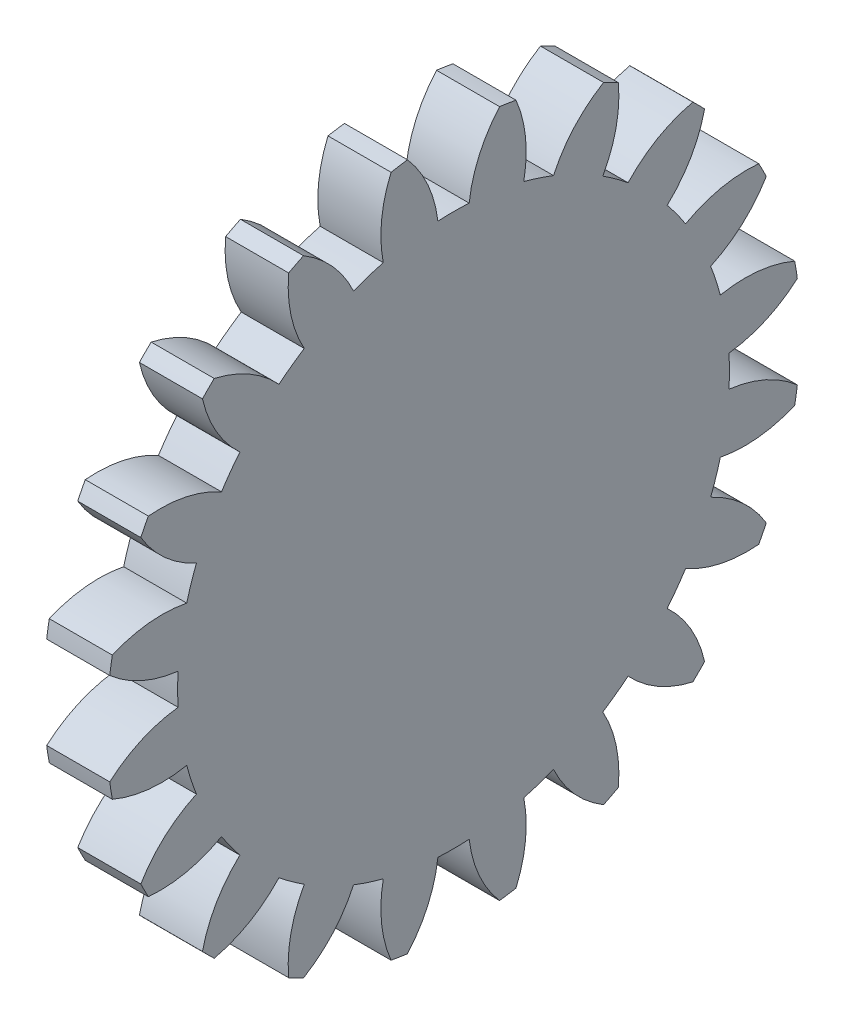
from build123d import *

# Parameters (mm, degrees)
ISO_START                                 = 2.649023341
ISO_SPUR_GEAR_1_5M_20T_20PA_3FW_2_R       = 0.4
ISO_SPUR_GEAR_1_5M_20T_20PA_3FW_S20_DEPTH = 3
BOSS_EXTRUDE1_DEPTH                       = 4
BOSS_EXTRUDE1_DEPTH_BACK                  = 3
SKETCH1_R                                 = 3
SKETCH2_R                                 = 2.4
CUT_EXTRUDE1_DEPTH                        = 3.2


# Read off the part's stored shape, not the designer's step: ISO - Spur gear 1.5M 20T 20PA 3FW ---S20A75H50L0.8N
with BuildPart() as part:
    # ISO - Spur gear 1.5M 20T 20PA 3FW -- 2 → ISO - Spur gear 1.5M 20T 20PA 3FW ---S20 (new body)
    with BuildSketch(Plane.YZ.offset(ISO_START)):
        with BuildLine():
            ThreePointArc((-13.663753379, 26.133903668), (-14.053655616, 26.200458221), (-14.445041168, 26.257647498))
            ThreePointArc((-14.445041168, 26.257647498), (-15.414573535, 24.741730478), (-15.891009909, 23.006505477))
            ThreePointArc((-15.891009909, 23.006505477), (-16.634824289, 23.027600602), (-17.37863867, 23.006505477))
            ThreePointArc((-17.37863867, 23.006505477), (-17.855075045, 24.741730477), (-18.824607411, 26.257647498))
            ThreePointArc((-18.824607411, 26.257647498), (-19.215992963, 26.200458221), (-19.6058952, 26.133903668))
            ThreePointArc((-19.6058952, 26.133903668), (-20.059531154, 24.39257893), (-19.976435058, 22.59505495))
            ThreePointArc((-19.976435058, 22.59505495), (-20.690363323, 22.385266321), (-21.391254085, 22.135352381))
            ThreePointArc((-21.391254085, 22.135352381), (-22.380586018, 23.638422489), (-23.771110214, 24.780543271))
            ThreePointArc((-23.771110214, 24.780543271), (-24.125667535, 24.605208251), (-24.475920111, 24.421424692))
            ThreePointArc((-24.475920111, 24.421424692), (-24.369254604, 22.625145234), (-23.734760063, 20.941276444))
            ThreePointArc((-23.734760063, 20.941276444), (-24.348917941, 20.521139636), (-24.938277012, 20.066870198))
            ThreePointArc((-24.938277012, 20.066870198), (-26.343661801, 21.190654438), (-28.01906363, 21.847180243))
            ThreePointArc((-28.01906363, 21.847180243), (-28.302086179, 21.570862491), (-28.578403931, 21.287839942))
            ThreePointArc((-28.578403931, 21.287839942), (-27.921878126, 19.612438113), (-26.798093886, 18.207053324))
            ThreePointArc((-26.798093886, 18.207053324), (-27.252363324, 17.617694253), (-27.672500133, 17.003536375))
            ThreePointArc((-27.672500133, 17.003536375), (-29.356368922, 17.638030916), (-31.15264838, 17.744696423))
            ThreePointArc((-31.15264838, 17.744696423), (-31.336431939, 17.394443847), (-31.511766959, 17.039886526))
            ThreePointArc((-31.511766959, 17.039886526), (-30.369646177, 15.64936233), (-28.866576069, 14.660030397))
            ThreePointArc((-28.866576069, 14.660030397), (-29.116490009, 13.959139635), (-29.326278638, 13.24521137))
            ThreePointArc((-29.326278638, 13.24521137), (-31.123802618, 13.328307466), (-32.865127356, 12.874671512))
            ThreePointArc((-32.865127356, 12.874671512), (-32.931681909, 12.484769275), (-32.988871186, 12.093383723))
            ThreePointArc((-32.988871186, 12.093383723), (-31.472954165, 11.123851357), (-29.737729165, 10.647414982))
            ThreePointArc((-29.737729165, 10.647414982), (-29.75882429, 9.903600602), (-29.737729165, 9.159786221))
            ThreePointArc((-29.737729165, 9.159786221), (-31.472954166, 8.683349847), (-32.988871186, 7.71381748))
            ThreePointArc((-32.988871186, 7.71381748), (-32.931681909, 7.322431928), (-32.865127356, 6.932529691))
            ThreePointArc((-32.865127356, 6.932529691), (-31.123802618, 6.478893737), (-29.326278638, 6.561989833))
            ThreePointArc((-29.326278638, 6.561989833), (-29.116490009, 5.848061568), (-28.866576069, 5.147170806))
            ThreePointArc((-28.866576069, 5.147170806), (-30.369646177, 4.157838873), (-31.511766959, 2.767314677))
            ThreePointArc((-31.511766959, 2.767314677), (-31.336431939, 2.412757356), (-31.15264838, 2.06250478))
            ThreePointArc((-31.15264838, 2.06250478), (-29.356368922, 2.169170287), (-27.672500133, 2.803664828))
            ThreePointArc((-27.672500133, 2.803664828), (-27.252363324, 2.18950695), (-26.798093886, 1.600147879))
            ThreePointArc((-26.798093886, 1.600147879), (-27.921878126, 0.19476309), (-28.578403931, -1.480638739))
            ThreePointArc((-28.578403931, -1.480638739), (-28.302086179, -1.763661288), (-28.01906363, -2.03997904))
            ThreePointArc((-28.01906363, -2.03997904), (-26.343661801, -1.383453235), (-24.938277012, -0.259668995))
            ThreePointArc((-24.938277012, -0.259668995), (-24.348917941, -0.713938433), (-23.734760063, -1.134075241))
            ThreePointArc((-23.734760063, -1.134075241), (-24.369254604, -2.817944031), (-24.475920111, -4.614223489))
            ThreePointArc((-24.475920111, -4.614223489), (-24.125667535, -4.798007048), (-23.771110214, -4.973342068))
            ThreePointArc((-23.771110214, -4.973342068), (-22.380586018, -3.831221286), (-21.391254085, -2.328151178))
            ThreePointArc((-21.391254085, -2.328151178), (-20.690363323, -2.578065118), (-19.976435058, -2.787853747))
            ThreePointArc((-19.976435058, -2.787853747), (-20.059531154, -4.585377727), (-19.6058952, -6.326702465))
            ThreePointArc((-19.6058952, -6.326702465), (-19.215992963, -6.393257018), (-18.824607411, -6.450446295))
            ThreePointArc((-18.824607411, -6.450446295), (-17.855075045, -4.934529274), (-17.37863867, -3.199304274))
            ThreePointArc((-17.37863867, -3.199304274), (-16.634824289, -3.220399398), (-15.891009909, -3.199304274))
            ThreePointArc((-15.891009909, -3.199304274), (-15.414573535, -4.934529275), (-14.445041168, -6.450446295))
            ThreePointArc((-14.445041168, -6.450446295), (-14.053655616, -6.393257018), (-13.663753379, -6.326702465))
            ThreePointArc((-13.663753379, -6.326702465), (-13.210117425, -4.585377727), (-13.293213521, -2.787853747))
            ThreePointArc((-13.293213521, -2.787853747), (-12.579285256, -2.578065118), (-11.878394494, -2.328151178))
            ThreePointArc((-11.878394494, -2.328151178), (-10.889062561, -3.831221286), (-9.498538365, -4.973342068))
            ThreePointArc((-9.498538365, -4.973342068), (-9.143981044, -4.798007048), (-8.793728468, -4.614223489))
            ThreePointArc((-8.793728468, -4.614223489), (-8.900393975, -2.817944031), (-9.534888516, -1.134075241))
            ThreePointArc((-9.534888516, -1.134075241), (-8.920730638, -0.713938433), (-8.331371567, -0.259668995))
            ThreePointArc((-8.331371567, -0.259668995), (-6.925986778, -1.383453235), (-5.250584949, -2.03997904))
            ThreePointArc((-5.250584949, -2.03997904), (-4.9675624, -1.763661288), (-4.691244648, -1.480638739))
            ThreePointArc((-4.691244648, -1.480638739), (-5.347770453, 0.19476309), (-6.471554693, 1.600147879))
            ThreePointArc((-6.471554693, 1.600147879), (-6.017285255, 2.18950695), (-5.597148447, 2.803664828))
            ThreePointArc((-5.597148447, 2.803664828), (-3.913279657, 2.169170287), (-2.117000199, 2.06250478))
            ThreePointArc((-2.117000199, 2.06250478), (-1.93321664, 2.412757356), (-1.75788162, 2.767314677))
            ThreePointArc((-1.75788162, 2.767314677), (-2.900002402, 4.157838873), (-4.40307251, 5.147170806))
            ThreePointArc((-4.40307251, 5.147170806), (-4.15315857, 5.848061568), (-3.943369941, 6.561989833))
            ThreePointArc((-3.943369941, 6.561989833), (-2.145845961, 6.478893737), (-0.404521223, 6.932529691))
            ThreePointArc((-0.404521223, 6.932529691), (-0.33796667, 7.322431928), (-0.280777393, 7.71381748))
            ThreePointArc((-0.280777393, 7.71381748), (-1.796694413, 8.683349847), (-3.531919414, 9.159786221))
            ThreePointArc((-3.531919414, 9.159786221), (-3.51082429, 9.903600601), (-3.531919414, 10.647414982))
            ThreePointArc((-3.531919414, 10.647414982), (-1.796694414, 11.123851357), (-0.280777393, 12.093383723))
            ThreePointArc((-0.280777393, 12.093383723), (-0.33796667, 12.484769275), (-0.404521223, 12.874671512))
            ThreePointArc((-0.404521223, 12.874671512), (-2.145845961, 13.328307466), (-3.943369941, 13.24521137))
            ThreePointArc((-3.943369941, 13.24521137), (-4.15315857, 13.959139635), (-4.40307251, 14.660030397))
            ThreePointArc((-4.40307251, 14.660030397), (-2.900002402, 15.64936233), (-1.75788162, 17.039886526))
            ThreePointArc((-1.75788162, 17.039886526), (-1.93321664, 17.394443847), (-2.117000199, 17.744696423))
            ThreePointArc((-2.117000199, 17.744696423), (-3.913279657, 17.638030916), (-5.597148447, 17.003536375))
            ThreePointArc((-5.597148447, 17.003536375), (-6.017285255, 17.617694253), (-6.471554693, 18.207053324))
            ThreePointArc((-6.471554693, 18.207053324), (-5.347770453, 19.612438113), (-4.691244648, 21.287839942))
            ThreePointArc((-4.691244648, 21.287839942), (-4.9675624, 21.570862491), (-5.250584949, 21.847180243))
            ThreePointArc((-5.250584949, 21.847180243), (-6.925986778, 21.190654438), (-8.331371567, 20.066870198))
            ThreePointArc((-8.331371567, 20.066870198), (-8.920730638, 20.521139636), (-9.534888516, 20.941276444))
            ThreePointArc((-9.534888516, 20.941276444), (-8.900393975, 22.625145234), (-8.793728468, 24.421424692))
            ThreePointArc((-8.793728468, 24.421424692), (-9.143981044, 24.605208251), (-9.498538365, 24.780543271))
            ThreePointArc((-9.498538365, 24.780543271), (-10.889062561, 23.638422489), (-11.878394494, 22.135352381))
            ThreePointArc((-11.878394494, 22.135352381), (-12.579285256, 22.385266321), (-13.293213521, 22.59505495))
            ThreePointArc((-13.293213521, 22.59505495), (-13.210117425, 24.39257893), (-13.663753379, 26.133903668))
        make_face()
        with Locations((-16.63482429, 9.903600602)):
            Circle(ISO_SPUR_GEAR_1_5M_20T_20PA_3FW_2_R, mode=Mode.SUBTRACT)
    extrude(amount=ISO_SPUR_GEAR_1_5M_20T_20PA_3FW_S20_DEPTH)

    # Sketch1 → Boss-Extrude1 (add, two sides: drawn at the far end of the back side and taken through both)
    with BuildSketch(Plane.ZY.offset(-2.649023341).offset(-BOSS_EXTRUDE1_DEPTH_BACK)):
        with Locations((9.903600602, -16.63482429)):
            Circle(SKETCH1_R)
    extrude(amount=BOSS_EXTRUDE1_DEPTH + BOSS_EXTRUDE1_DEPTH_BACK)

    # Sketch2 → Cut-Extrude1 (cut)
    with BuildSketch(Plane.ZY.offset(1.350976659)):
        with Locations((9.903600602, -16.63482429)):
            Circle(SKETCH2_R)
    extrude(amount=-CUT_EXTRUDE1_DEPTH, mode=Mode.SUBTRACT)


solid = part.part
